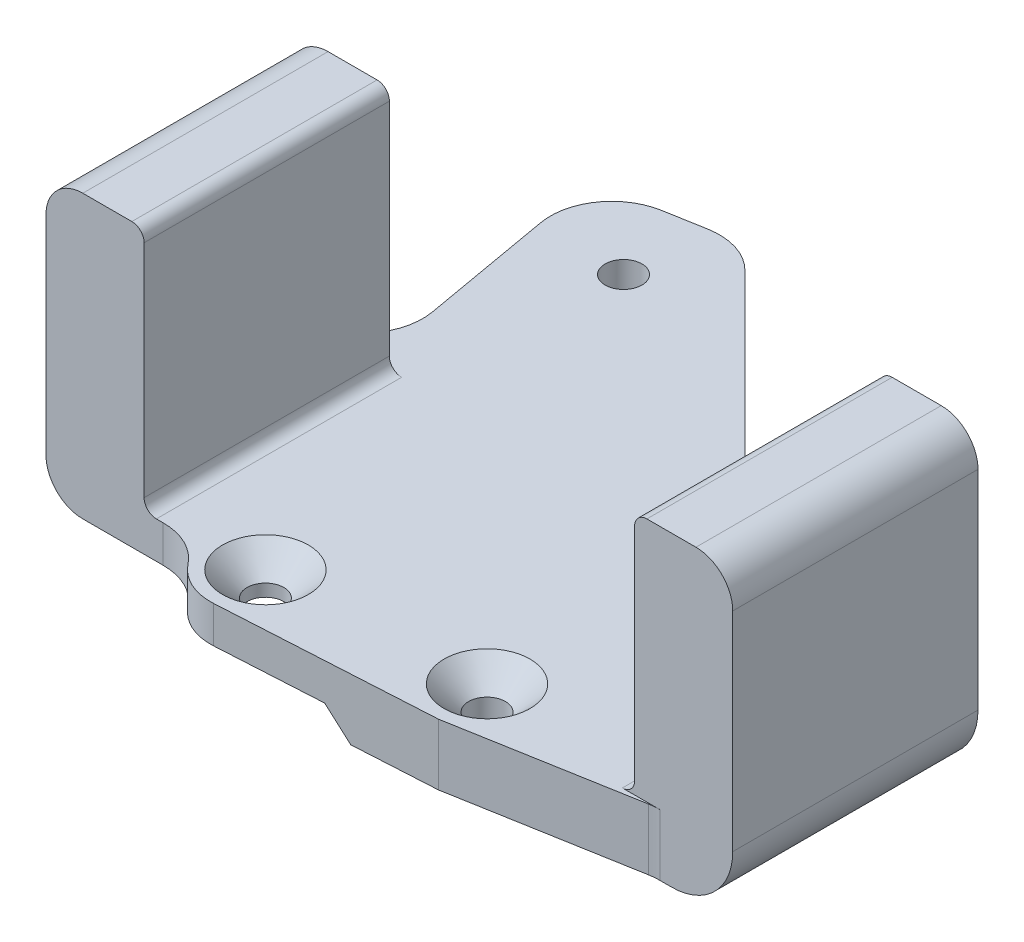
from build123d import *

# Parameters (mm, degrees)
ESQUISSE1_R             = 0.85
BOSS_EXTRU_1_DEPTH      = 20
BOSS_EXTRU_2_DEPTH      = 5
ESQUISSE3_R             = 1.5
ENL_V_MAT_EXTRU_1_DEPTH = 47.234781527
CONG_1_R                = 1
CONG_2_R                = 3
CHANFREIN2_SIZE         = 2
ENL_V_MAT_EXTRU_2_DEPTH = 2
CHANFREIN3_SIZE         = 2
ENL_V_MAT_EXTRU_3_DEPTH = 47.234781527
CONG_3_R                = 5
CONG_4_R                = 3
BOSS_EXTRU_3_DEPTH      = 0.2


with BuildPart() as part:
    # Esquisse1 → Boss.-Extru.1 (new body)
    with BuildSketch(Plane.XY):
        Polygon((20, 25), (28, 25), (28, 0), (-28, 0), (-28, 25), (-20, 25), (-20, 5), (20, 5), align=None)
        with Locations((-24, 20)):
            Circle(ESQUISSE1_R, mode=Mode.SUBTRACT)
        with Locations((-24, 10)):
            Circle(ESQUISSE1_R, mode=Mode.SUBTRACT)
        with Locations(Location((24, 10, 0), (0, 0, 180))):
            Circle(ESQUISSE1_R, mode=Mode.SUBTRACT)
        with Locations(Location((24, 20, 0), (0, 0, 180))):
            Circle(ESQUISSE1_R, mode=Mode.SUBTRACT)
    extrude(amount=BOSS_EXTRU_1_DEPTH)

    # Esquisse2 → Boss.-Extru.2 (add)
    with BuildSketch(Plane(origin=(0, 5, 0), x_dir=(1, 0, 0), z_dir=(0, 1, 0))):
        Polygon((-25.117673753, 21.515226358), (28, 30.881305394), (28, -18.874598589), (-16.608913047, -26.740353539), align=None)
    extrude(amount=-BOSS_EXTRU_2_DEPTH)

    # Esquisse3 → Enlèv. mat.-Extru.1 (cut, through all)
    with BuildSketch(Plane(origin=(0, 5, 0), x_dir=(1, 0, 0), z_dir=(0, 1, 0))):
        with Locations(Location((-17.211954407, 16.307159752, 0), (0, 0, 270))):
            Circle(ESQUISSE3_R)
        with Locations(Location((6.128408145, -18.163515842, 0), (0, 0, 270))):
            Circle(ESQUISSE3_R)
        with Locations(Location((-10.960620011, -19.145919356, 0), (0, 0, 270))):
            Circle(ESQUISSE3_R)
    extrude(amount=-ENL_V_MAT_EXTRU_1_DEPTH, mode=Mode.SUBTRACT)

    # Congé1
    cong_1_edges = [part.edges().sort_by_distance(p)[0] for p in [
        (-20, 25, 10),
        (-20, 5, 10),
        (20, 5, 10),
        (20, 25, 10),
    ]]
    fillet(cong_1_edges, radius=CONG_1_R)

    # Congé2
    cong_2_edges = [part.edges().sort_by_distance(p)[0] for p in [
        (-28, 25, 10),
        (28, 25, 10),
    ]]
    fillet(cong_2_edges, radius=CONG_2_R)

    # Chanfrein2
    chanfrein2_edges = [part.edges().sort_by_distance(p)[0] for p in [
        (-10.960620011, 5, 17.645919356),
        (6.128408145, 5, 16.663515842),
    ]]
    chamfer(chanfrein2_edges, length=CHANFREIN2_SIZE)

    # Esquisse4 → Enlèv. mat.-Extru.2 (cut)
    with BuildSketch(Plane.XZ):
        Polygon((-48.23971452, 32.31771726), (0.015865378, 23.808956555), (-8.492895328, -24.446623343), (-56.748475225, -15.937862637), align=None)
    extrude(amount=-ENL_V_MAT_EXTRU_2_DEPTH, mode=Mode.SUBTRACT)

    # Chanfrein3
    chanfrein3_edges = [part.edges().sort_by_distance(p)[0] for p in [
        (-4.238514975, 2, -0.318833394),
    ]]
    chamfer(chanfrein3_edges, length=CHANFREIN3_SIZE - 0.0001)  # a hair under: the kernel refuses the full size

    # Esquisse5 → Enlèv. mat.-Extru.3 (cut, through all)
    with BuildSketch(Plane(origin=(0, 5, 0), x_dir=(1, 0, 0), z_dir=(0, 1, 0))):
        with BuildLine():
            Line((-28, -20), (-15.377035546, -20))
            ThreePointArc((-15.377035546, -20), (-13.722728197, -22.696262762), (-10.702454097, -23.636746706))
            Line((-10.702454097, -23.636746706), (6.649832575, -22.639209149))
            Line((6.649832575, -22.639209149), (6.649832575, -26.740353539))
            Line((6.649832575, -26.740353539), (-28, -26.740353539))
            Line((-28, -26.740353539), (-28, -20))
        make_face()
        Polygon((28, 30.881305394), (-21.886605112, 30.881305394), (8.994700282, 0), (28, 0), align=None)
    extrude(amount=-ENL_V_MAT_EXTRU_3_DEPTH, mode=Mode.SUBTRACT)

    # Congé3
    cong_3_edges = [part.edges().sort_by_distance(p)[0] for p in [
        (28, 0, 10),
        (-25.117673753, 3.5, -21.515226358),
        (-15.377035546, 3.5, 20),
        (-14.408791034, 3.5, -23.403491315),
        (8.994700282, 2.5, 0),
        (-21.32395885, 3.5, 0),
        (21.617531437, 2.5, 20),
    ]]
    fillet(cong_3_edges, radius=CONG_3_R)

    # Congé4
    cong_4_edges = [part.edges().sort_by_distance(p)[0] for p in [
        (-28, 2, 10),
    ]]
    fillet(cong_4_edges, radius=CONG_4_R)

    # Esquisse6 → Boss.-Extru.3 (add)
    with BuildSketch(Plane.XY.offset(20)):
        with BuildLine():
            Line((-28, 22), (-28, 5))
            ThreePointArc((-28, 5), (-27.121320344, 2.878679656), (-25, 2))
            Line((-25, 2), (-18.440348512, 2))
            Line((-18.440348512, 2), (-18.440348512, 5))
            Line((-18.440348512, 5), (-19, 5))
            ThreePointArc((-19, 5), (-19.707106781, 5.292893219), (-20, 6))
            Line((-20, 6), (-20, 24))
            ThreePointArc((-20, 24), (-20.292893219, 24.707106781), (-21, 25))
            Line((-21, 25), (-25, 25))
            ThreePointArc((-25, 25), (-27.121320344, 24.121320344), (-28, 22))
        make_face()
        with BuildLine():
            Line((19, 5), (22.054974755, 5))
            Line((22.054974755, 5), (22.054974755, 0))
            Line((22.054974755, 0), (23, 0))
            ThreePointArc((23, 0), (26.535533906, 1.464466094), (28, 5))
            Line((28, 5), (28, 22))
            ThreePointArc((28, 22), (27.121320344, 24.121320344), (25, 25))
            Line((25, 25), (21, 25))
            ThreePointArc((21, 25), (20.292893219, 24.707106781), (20, 24))
            Line((20, 24), (20, 6))
            ThreePointArc((20, 6), (19.707106781, 5.292893219), (19, 5))
        make_face()
    extrude(amount=-BOSS_EXTRU_3_DEPTH)


solid = part.part
